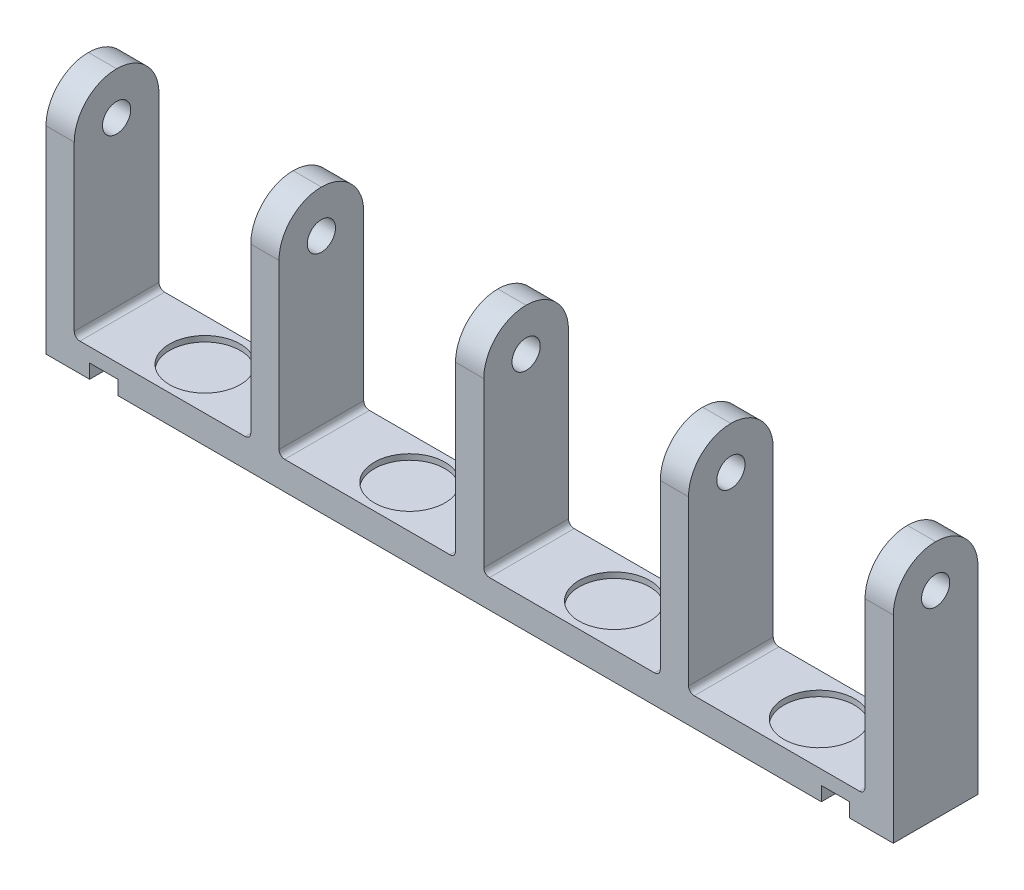
from build123d import *

# Parameters (mm, degrees)
SKETCH1_W            = 300
SKETCH1_H            = 30
BOSS_EXTRUDE1_DEPTH  = 5
SKETCH2_W            = 10
SKETCH2_H            = 30
CUT_EXTRUDE1_DEPTH   = 5
SKETCH3_W            = 10
SKETCH3_H            = 75
BOSS_EXTRUDE2_DEPTH  = 15
FILLET1_R            = 15
SKETCH4_R            = 5
CUT_EXTRUDE2_DEPTH   = 311.845620847
FILLET2_R            = 15
FILLET3_R            = 2
SKETCH5_R            = 12.5
CUT_EXTRUDE3_DEPTH   = 2
LPATTERN1_COUNT      = 3
LPATTERN1_PITCH      = 72.5
LPATTERN1_COUNT_DIR2 = 3
LPATTERN1_PITCH_DIR2 = 72.5


with BuildPart() as part:
    # Sketch1 → Boss-Extrude1 (new, symmetric)
    with BuildSketch(Plane(origin=(0, 0, 0), x_dir=(1, 0, 0), z_dir=(0, 1, 0))):
        Rectangle(SKETCH1_W, SKETCH1_H)
    extrude(amount=BOSS_EXTRUDE1_DEPTH, both=True)

    # Sketch2 → Cut-Extrude1 (cut)
    with BuildSketch(Plane.XZ.offset(5)):
        with Locations((-129.545, 0)):
            Rectangle(SKETCH2_W, SKETCH2_H)
        with Locations((129.545, 0)):
            Rectangle(SKETCH2_W, SKETCH2_H)
    extrude(amount=-CUT_EXTRUDE1_DEPTH, mode=Mode.SUBTRACT)

    # Sketch3 → Boss-Extrude2 (add, symmetric)
    with BuildSketch(Plane.XY):
        with Locations((-145, 42.5)):
            Rectangle(SKETCH3_W, SKETCH3_H)
        with Locations((145, 42.5)):
            Rectangle(SKETCH3_W, SKETCH3_H)
        with Locations((-72.5, 42.5)):
            Rectangle(SKETCH3_W, SKETCH3_H)
        with Locations((72.5, 42.5)):
            Rectangle(SKETCH3_W, SKETCH3_H)
        with Locations((0, 42.5)):
            Rectangle(SKETCH3_W, SKETCH3_H)
    extrude(amount=BOSS_EXTRUDE2_DEPTH, both=True)

    # Fillet1
    fillet1_edges = [part.edges().sort_by_distance(p)[0] for p in [
        (145, 80, -15),
        (145, 80, 15),
        (-145, 80, -15),
        (-145, 80, 15),
    ]]
    fillet(fillet1_edges, radius=FILLET1_R - 0.0001)  # a hair under: the kernel refuses the full size

    # Sketch4 → Cut-Extrude2 (cut, through all)
    with BuildSketch(Plane.ZY.offset(150)):
        with Locations((0, 65)):
            Circle(SKETCH4_R)
    extrude(amount=-CUT_EXTRUDE2_DEPTH, mode=Mode.SUBTRACT)

    # Fillet2
    fillet2_edges = [part.edges().sort_by_distance(p)[0] for p in [
        (72.5, 80, -15),
        (72.5, 80, 15),
        (0, 80, -15),
        (0, 80, 15),
        (-72.5, 80, -15),
        (-72.5, 80, 15),
    ]]
    fillet(fillet2_edges, radius=FILLET2_R - 0.0001)  # a hair under: the kernel refuses the full size

    # Fillet3
    fillet3_edges = [part.edges().sort_by_distance(p)[0] for p in [
        (-140, 5, 0),
        (140, 5, 0),
        (-77.5, 5, 0),
        (-67.5, 5, 0),
        (67.5, 5, 0),
        (77.5, 5, 0),
        (-5, 5, 0),
        (5, 5, 0),
    ]]
    fillet(fillet3_edges, radius=FILLET3_R)

    # Sketch5 → Cut-Extrude3 (cut)
    with BuildSketch(Plane(origin=(0, 5, 0), x_dir=(1, 0, 0), z_dir=(0, 1, 0))):
        with Locations(Location((36.25, 0, 0), (0, 0, 270))):
            Circle(SKETCH5_R)
    cut_extrude3 = extrude(amount=-CUT_EXTRUDE3_DEPTH, mode=Mode.SUBTRACT)

    # LPattern1: Cut-Extrude3 3 × 3
    with Locations(*[Vector(-1, 0, 0) * (i * LPATTERN1_PITCH) + Vector(1, 0, 0) * (j * LPATTERN1_PITCH_DIR2) for i in range(LPATTERN1_COUNT) for j in range(LPATTERN1_COUNT_DIR2) if (i, j) != (0, 0)]):
        add(cut_extrude3, mode=Mode.SUBTRACT)


solid = part.part
